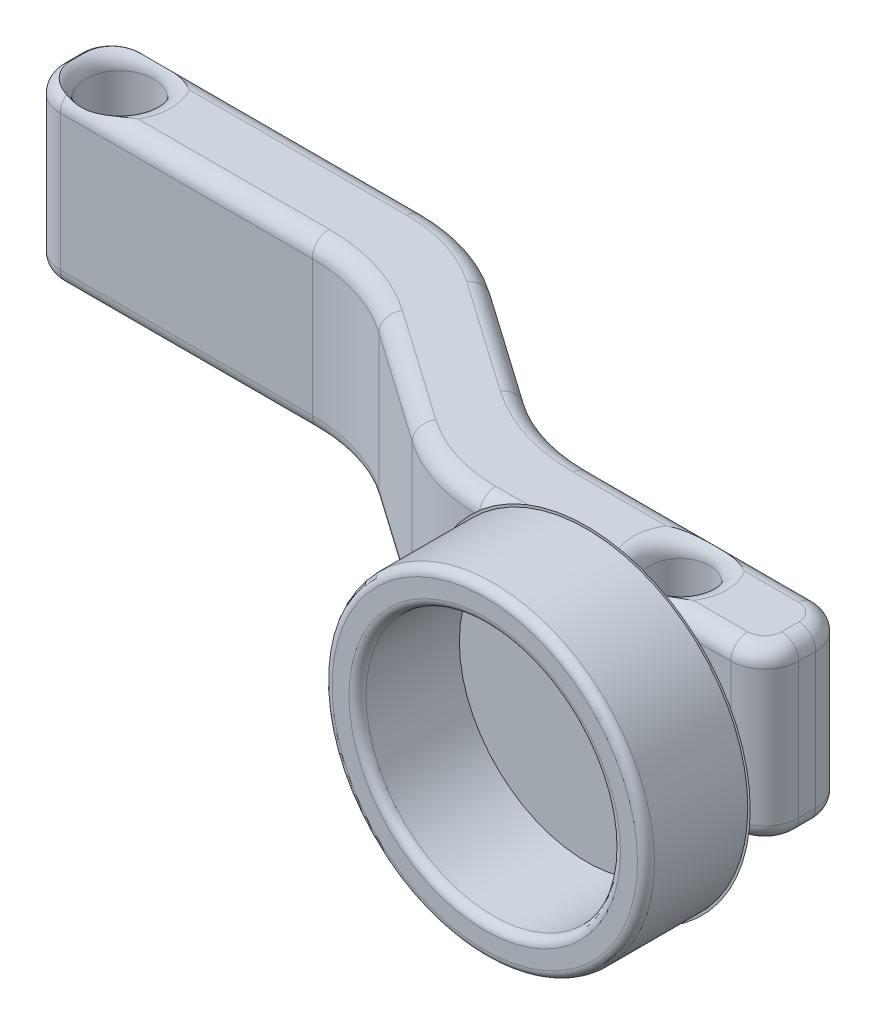
from build123d import *

# Parameters (mm, degrees)
BOSS_EXTRUDE1_DEPTH = 10
SKETCH2_R           = 1.75
SKETCH2_R_2         = 2
CUT_EXTRUDE1_DEPTH  = 10
FILLET2_R           = 1
SKETCH4_R           = 4
BOSS_EXTRUDE3_DEPTH = 3
BOSS_EXTRUDE3_DRAFT = -62
SKETCH3_R           = 9.5
SKETCH3_R_2         = 7.5
BOSS_EXTRUDE2_DEPTH = 6
FILLET4_R           = 0.5


with BuildPart() as part:
    # Sketch1 → Boss-Extrude1 (new body)
    with BuildSketch(Plane(origin=(0, 0, 0), x_dir=(1, 0, 0), z_dir=(0, 1, 0))):
        with BuildLine():
            Line((-2, 0), (-16.847012111, 0))
            ThreePointArc((-16.847012111, 0), (-19.854070106, 0.462830493), (-22.582776475, 1.808479557))
            Line((-22.582776475, 1.808479557), (-29.137351189, 6.398042182))
            ThreePointArc((-29.137351189, 6.398042182), (-31.866057558, 7.743691247), (-34.873115553, 8.206521739))
            Line((-34.873115553, 8.206521739), (-49.720127664, 8.206521739))
            ThreePointArc((-49.720127664, 8.206521739), (-51.134341226, 8.792308177), (-51.720127664, 10.206521739))
            Line((-51.720127664, 10.206521739), (-51.720127664, 11.206521739))
            ThreePointArc((-51.720127664, 11.206521739), (-51.134341226, 12.620735302), (-49.720127664, 13.206521739))
            Line((-49.720127664, 13.206521739), (-33.296621608, 13.206521739))
            ThreePointArc((-33.296621608, 13.206521739), (-30.289563613, 12.743691247), (-27.560857245, 11.398042182))
            Line((-27.560857245, 11.398042182), (-21.00628253, 6.808479557))
            ThreePointArc((-21.00628253, 6.808479557), (-18.277576162, 5.462830493), (-15.270518167, 5))
            Line((-15.270518167, 5), (-2, 5))
            ThreePointArc((-2, 5), (-0.585786438, 4.414213562), (0, 3))
            Line((0, 3), (0, 2))
            ThreePointArc((0, 2), (-0.585786438, 0.585786438), (-2, 0))
        make_face()
    extrude(amount=BOSS_EXTRUDE1_DEPTH)

    # Sketch2 → Cut-Extrude1 (cut)
    with BuildSketch(Plane(origin=(0, 10, 0), x_dir=(1, 0, 0), z_dir=(0, 1, 0))):
        with Locations(Location((-7.5, 2.5, 0), (0, 0, 270))):
            Circle(SKETCH2_R)
        with Locations(Location((-48.720127664, 10.706521739, 0), (0, 0, 270))):
            Circle(SKETCH2_R_2)
    extrude(amount=-CUT_EXTRUDE1_DEPTH, mode=Mode.SUBTRACT)

    # Fillet2
    # the kernel refuses this fillet: 1 mm, written as the material it takes off along each edge
    with BuildSketch(Plane(origin=(-2, 10, -2), x_dir=(1, 0, 0), z_dir=(0, 0, -1))) as fillet2_piece_1:
        with BuildLine():
            CenterArc((2 - FILLET2_R, FILLET2_R), FILLET2_R, 270, 90)
            Line((2, FILLET2_R), (2, 0))
            Line((2, 0), (2 - FILLET2_R, 0))
        make_face()
    revolve(axis=Axis((-2, 10, -2), (0, -1, 0)), revolution_arc=90, mode=Mode.SUBTRACT)
    with BuildSketch(Plane(origin=(-22.582776475, 0, -1.808479557), x_dir=(0.5735764363510469, 0, -0.8191520442889912), z_dir=(-0.8191520442889912, 0, -0.5735764363510469)), Plane(origin=(-27.560857245, 10, -11.398042182), x_dir=(0, -1, 0), z_dir=(0.8191520442889902, 0, 0.5735764363510484))) as fillet2_piece_2:
        with BuildLine():
            CenterArc((FILLET2_R, -FILLET2_R), FILLET2_R, 90, 90)
            Line((0, -FILLET2_R), (0, 0))
            Line((0, 0), (FILLET2_R, 0))
        make_face()
    extrude(amount=8.001658252, mode=Mode.SUBTRACT)
    with BuildSketch(Plane(origin=(-34.873115553, 0, 1.793478261), x_dir=(0.5735764363510476, 0, -0.8191520442889908), z_dir=(0.8191520442889908, 0, 0.5735764363510476))) as fillet2_piece_3:
        with BuildLine():
            CenterArc((10 + FILLET2_R, FILLET2_R), FILLET2_R, 180, 90)
            Line((10, FILLET2_R), (10, 0))
            Line((10, 0), (10 + FILLET2_R, 0))
        make_face()
    revolve(axis=Axis((-34.873115553, 0, 1.793478261), (0, 1, 0)), revolution_arc=35, mode=Mode.SUBTRACT)
    with BuildSketch(Plane(origin=(-34.873115553, 0, -8.206521739), x_dir=(0, 0, -1), z_dir=(-1, 0, 0)), Plane(origin=(-2, 0, 0), x_dir=(0, 0, -1), z_dir=(-1, 0, 0))) as fillet2_piece_4:
        with BuildLine():
            CenterArc((FILLET2_R, -FILLET2_R), FILLET2_R, 90, 90)
            Line((0, -FILLET2_R), (0, 0))
            Line((0, 0), (FILLET2_R, 0))
        make_face()
    extrude(amount=14.847012111, mode=Mode.SUBTRACT)
    with BuildSketch(Plane(origin=(0, 10, -3), x_dir=(-1, 0, 0), z_dir=(0, 0, 1)), Plane(origin=(-51.720127664, 10, -10.206521739), x_dir=(1, 0, 0), z_dir=(0, 0, -1))) as fillet2_piece_5:
        with BuildLine():
            CenterArc((FILLET2_R, FILLET2_R), FILLET2_R, 180, 90)
            Line((0, FILLET2_R), (0, 0))
            Line((0, 0), (FILLET2_R, 0))
        make_face()
    extrude(amount=1, mode=Mode.SUBTRACT)
    with BuildSketch(Plane(origin=(-49.720127664, 0, -10.206521739), x_dir=(0, 0, 1), z_dir=(1, 0, 0))) as fillet2_piece_6:
        with BuildLine():
            CenterArc((2 - FILLET2_R, -FILLET2_R), FILLET2_R, 0, 90)
            Line((2, -FILLET2_R), (2, 0))
            Line((2, 0), (2 - FILLET2_R, 0))
        make_face()
    revolve(axis=Axis((-49.720127664, 0, -10.206521739), (0, -1, 0)), revolution_arc=90, mode=Mode.SUBTRACT)
    with BuildSketch(Plane(origin=(-51.720127664, 0, -10.206521739), x_dir=(1, 0, 0), z_dir=(0, 0, -1)), Plane(origin=(0, 0, -3), x_dir=(-1, 0, 0), z_dir=(0, 0, 1))) as fillet2_piece_7:
        with BuildLine():
            CenterArc((FILLET2_R, -FILLET2_R), FILLET2_R, 90, 90)
            Line((0, -FILLET2_R), (0, 0))
            Line((0, 0), (FILLET2_R, 0))
        make_face()
    extrude(amount=1, mode=Mode.SUBTRACT)
    with BuildSketch(Plane(origin=(-49.720127664, 0, -11.206521739), x_dir=(-1, 0, 0), z_dir=(0, 0, 1))) as fillet2_piece_8:
        with BuildLine():
            CenterArc((2 - FILLET2_R, -FILLET2_R), FILLET2_R, 0, 90)
            Line((2, -FILLET2_R), (2, 0))
            Line((2, 0), (2 - FILLET2_R, 0))
        make_face()
    revolve(axis=Axis((-49.720127664, 0, -11.206521739), (0, -1, 0)), revolution_arc=90, mode=Mode.SUBTRACT)
    with BuildSketch(Plane(origin=(-49.720127664, 0, -13.206521739), x_dir=(0, 0, 1), z_dir=(1, 0, 0))) as fillet2_piece_9:
        with BuildLine():
            CenterArc((FILLET2_R, -FILLET2_R), FILLET2_R, 90, 90)
            Line((0, -FILLET2_R), (0, 0))
            Line((0, 0), (FILLET2_R, 0))
        make_face()
    extrude(amount=16.423506056, mode=Mode.SUBTRACT)
    with BuildSketch(Plane(origin=(-33.296621608, 0, -3.206521739), x_dir=(0, 0, -1), z_dir=(-1, 0, 0))) as fillet2_piece_10:
        with BuildLine():
            CenterArc((10 - FILLET2_R, -FILLET2_R), FILLET2_R, 0, 90)
            Line((10 - FILLET2_R, 0), (10, 0))
            Line((10, 0), (10, -FILLET2_R))
        make_face()
    revolve(axis=Axis((-33.296621608, 0, -3.206521739), (0, -1, 0)), revolution_arc=35, mode=Mode.SUBTRACT)
    with BuildSketch(Plane(origin=(-27.560857245, 0, -11.398042182), x_dir=(0, 1, 0), z_dir=(0.8191520442889902, 0, 0.5735764363510484)), Plane(origin=(-22.582776475, 10, -1.808479557), x_dir=(0.5735764363510469, 0, -0.8191520442889912), z_dir=(-0.8191520442889912, 0, -0.5735764363510469))) as fillet2_piece_11:
        with BuildLine():
            CenterArc((FILLET2_R, FILLET2_R), FILLET2_R, 180, 90)
            Line((0, FILLET2_R), (0, 0))
            Line((0, 0), (FILLET2_R, 0))
        make_face()
    extrude(amount=8.001658252, mode=Mode.SUBTRACT)
    with BuildSketch(Plane(origin=(-15.270518167, 0, -15), x_dir=(-0.573576436351048, 0, 0.8191520442889905), z_dir=(-0.8191520442889905, 0, -0.573576436351048))) as fillet2_piece_12:
        with BuildLine():
            CenterArc((10 + FILLET2_R, FILLET2_R), FILLET2_R, 180, 90)
            Line((10 + FILLET2_R, 0), (10, 0))
            Line((10, 0), (10, FILLET2_R))
        make_face()
    revolve(axis=Axis((-15.270518167, 0, -15), (0, 1, 0)), revolution_arc=35, mode=Mode.SUBTRACT)
    with BuildSketch(Plane(origin=(-15.270518167, 0, -5), x_dir=(0, 0, 1), z_dir=(1, 0, 0))) as fillet2_piece_13:
        with BuildLine():
            CenterArc((FILLET2_R, -FILLET2_R), FILLET2_R, 90, 90)
            Line((0, -FILLET2_R), (0, 0))
            Line((0, 0), (FILLET2_R, 0))
        make_face()
    extrude(amount=13.270518167, mode=Mode.SUBTRACT)
    with BuildSketch(Plane(origin=(-2, 0, -3), x_dir=(0, 0, -1), z_dir=(-1, 0, 0))) as fillet2_piece_14:
        with BuildLine():
            CenterArc((2 - FILLET2_R, -FILLET2_R), FILLET2_R, 0, 90)
            Line((2, -FILLET2_R), (2, 0))
            Line((2, 0), (2 - FILLET2_R, 0))
        make_face()
    revolve(axis=Axis((-2, 0, -3), (0, -1, 0)), revolution_arc=90, mode=Mode.SUBTRACT)
    with BuildSketch(Plane(origin=(-2, 10, -3), x_dir=(0, 0, -1), z_dir=(-1, 0, 0))) as fillet2_piece_15:
        with BuildLine():
            CenterArc((2 - FILLET2_R, FILLET2_R), FILLET2_R, 270, 90)
            Line((2, FILLET2_R), (2, 0))
            Line((2, 0), (2 - FILLET2_R, 0))
        make_face()
    revolve(axis=Axis((-2, 10, -3), (0, -1, 0)), revolution_arc=90, mode=Mode.SUBTRACT)
    with BuildSketch(Plane(origin=(-2, 0, -2), x_dir=(1, 0, 0), z_dir=(0, 0, -1))) as fillet2_piece_16:
        with BuildLine():
            CenterArc((2 - FILLET2_R, -FILLET2_R), FILLET2_R, 0, 90)
            Line((2, -FILLET2_R), (2, 0))
            Line((2, 0), (2 - FILLET2_R, 0))
        make_face()
    revolve(axis=Axis((-2, 0, -2), (0, -1, 0)), revolution_arc=90, mode=Mode.SUBTRACT)
    with BuildSketch(Plane(origin=(-16.847012111, 0, -10), x_dir=(0, 0, 1), z_dir=(1, 0, 0))) as fillet2_piece_17:
        with BuildLine():
            CenterArc((10 - FILLET2_R, -FILLET2_R), FILLET2_R, 0, 90)
            Line((10, -FILLET2_R), (10, 0))
            Line((10, 0), (10 - FILLET2_R, 0))
        make_face()
    revolve(axis=Axis((-16.847012111, 0, -10), (0, -1, 0)), revolution_arc=35, mode=Mode.SUBTRACT)
    with BuildSketch(Plane(origin=(-15.270518167, 10, -5), x_dir=(0, 0, 1), z_dir=(1, 0, 0))) as fillet2_piece_18:
        with BuildLine():
            CenterArc((FILLET2_R, FILLET2_R), FILLET2_R, 180, 90)
            Line((0, FILLET2_R), (0, 0))
            Line((0, 0), (FILLET2_R, 0))
        make_face()
    extrude(amount=13.270518167, mode=Mode.SUBTRACT)
    with BuildSketch(Plane(origin=(-15.270518167, 10, -15), x_dir=(-0.573576436351048, 0, 0.8191520442889905), z_dir=(-0.8191520442889905, 0, -0.573576436351048))) as fillet2_piece_19:
        with BuildLine():
            CenterArc((10 + FILLET2_R, -FILLET2_R), FILLET2_R, 90, 90)
            Line((10 + FILLET2_R, 0), (10, 0))
            Line((10, 0), (10, -FILLET2_R))
        make_face()
    revolve(axis=Axis((-15.270518167, 10, -15), (0, 1, 0)), revolution_arc=35, mode=Mode.SUBTRACT)
    with BuildSketch(Plane(origin=(-33.296621608, 10, -3.206521739), x_dir=(0, 0, -1), z_dir=(-1, 0, 0))) as fillet2_piece_20:
        with BuildLine():
            CenterArc((10 - FILLET2_R, FILLET2_R), FILLET2_R, 270, 90)
            Line((10 - FILLET2_R, 0), (10, 0))
            Line((10, 0), (10, FILLET2_R))
        make_face()
    revolve(axis=Axis((-33.296621608, 10, -3.206521739), (0, -1, 0)), revolution_arc=35, mode=Mode.SUBTRACT)
    with BuildSketch(Plane(origin=(-49.720127664, 10, -13.206521739), x_dir=(0, 0, 1), z_dir=(1, 0, 0))) as fillet2_piece_21:
        with BuildLine():
            CenterArc((FILLET2_R, FILLET2_R), FILLET2_R, 180, 90)
            Line((0, FILLET2_R), (0, 0))
            Line((0, 0), (FILLET2_R, 0))
        make_face()
    extrude(amount=16.423506056, mode=Mode.SUBTRACT)
    with BuildSketch(Plane(origin=(-49.720127664, 10, -11.206521739), x_dir=(-1, 0, 0), z_dir=(0, 0, 1))) as fillet2_piece_22:
        with BuildLine():
            CenterArc((2 - FILLET2_R, FILLET2_R), FILLET2_R, 270, 90)
            Line((2, FILLET2_R), (2, 0))
            Line((2, 0), (2 - FILLET2_R, 0))
        make_face()
    revolve(axis=Axis((-49.720127664, 10, -11.206521739), (0, -1, 0)), revolution_arc=90, mode=Mode.SUBTRACT)
    with BuildSketch(Plane(origin=(-16.847012111, 10, -10), x_dir=(0, 0, 1), z_dir=(1, 0, 0))) as fillet2_piece_23:
        with BuildLine():
            CenterArc((10 - FILLET2_R, FILLET2_R), FILLET2_R, 270, 90)
            Line((10, FILLET2_R), (10, 0))
            Line((10, 0), (10 - FILLET2_R, 0))
        make_face()
    revolve(axis=Axis((-16.847012111, 10, -10), (0, -1, 0)), revolution_arc=35, mode=Mode.SUBTRACT)
    with BuildSketch(Plane(origin=(-7.5, 0, -2.5), x_dir=(0, 0, 1), z_dir=(-1, 0, 0))) as fillet2_piece_24:
        with BuildLine():
            CenterArc((1.75 + FILLET2_R, FILLET2_R), FILLET2_R, 180, 90)
            Line((1.75, FILLET2_R), (1.75, 0))
            Line((1.75, 0), (1.75 + FILLET2_R, 0))
        make_face()
    revolve(axis=Axis((-7.5, 0, -2.5), (0, 1, 0)), mode=Mode.SUBTRACT)
    with BuildSketch(Plane(origin=(-7.5, 10, -2.5), x_dir=(0, 0, 1), z_dir=(-1, 0, 0))) as fillet2_piece_25:
        with BuildLine():
            CenterArc((1.75 + FILLET2_R, -FILLET2_R), FILLET2_R, 90, 90)
            Line((1.75, -FILLET2_R), (1.75, 0))
            Line((1.75, 0), (1.75 + FILLET2_R, 0))
        make_face()
    revolve(axis=Axis((-7.5, 10, -2.5), (0, 1, 0)), mode=Mode.SUBTRACT)
    with BuildSketch(Plane(origin=(-49.720127664, 10, -10.206521739), x_dir=(0, 0, 1), z_dir=(1, 0, 0))) as fillet2_piece_26:
        with BuildLine():
            CenterArc((2 - FILLET2_R, FILLET2_R), FILLET2_R, 270, 90)
            Line((2, FILLET2_R), (2, 0))
            Line((2, 0), (2 - FILLET2_R, 0))
        make_face()
    revolve(axis=Axis((-49.720127664, 10, -10.206521739), (0, -1, 0)), revolution_arc=90, mode=Mode.SUBTRACT)
    with BuildSketch(Plane(origin=(-48.720127664, 0, -10.706521739), x_dir=(0, 0, 1), z_dir=(-1, 0, 0))) as fillet2_piece_27:
        with BuildLine():
            CenterArc((2 + FILLET2_R, FILLET2_R), FILLET2_R, 180, 90)
            Line((2, FILLET2_R), (2, 0))
            Line((2, 0), (2 + FILLET2_R, 0))
        make_face()
    revolve(axis=Axis((-48.720127664, 0, -10.706521739), (0, 1, 0)), mode=Mode.SUBTRACT)
    with BuildSketch(Plane(origin=(-48.720127664, 10, -10.706521739), x_dir=(0, 0, 1), z_dir=(-1, 0, 0))) as fillet2_piece_28:
        with BuildLine():
            CenterArc((2 + FILLET2_R, -FILLET2_R), FILLET2_R, 90, 90)
            Line((2, -FILLET2_R), (2, 0))
            Line((2, 0), (2 + FILLET2_R, 0))
        make_face()
    revolve(axis=Axis((-48.720127664, 10, -10.706521739), (0, 1, 0)), mode=Mode.SUBTRACT)
    with BuildSketch(Plane(origin=(-34.873115553, 10, -8.206521739), x_dir=(0, 0, -1), z_dir=(-1, 0, 0)), Plane(origin=(-2, 10, 0), x_dir=(0, 0, -1), z_dir=(-1, 0, 0))) as fillet2_piece_29:
        with BuildLine():
            CenterArc((FILLET2_R, FILLET2_R), FILLET2_R, 180, 90)
            Line((0, FILLET2_R), (0, 0))
            Line((0, 0), (FILLET2_R, 0))
        make_face()
    extrude(amount=14.847012111, mode=Mode.SUBTRACT)
    with BuildSketch(Plane(origin=(-34.873115553, 10, 1.793478261), x_dir=(0.5735764363510476, 0, -0.8191520442889908), z_dir=(0.8191520442889908, 0, 0.5735764363510476))) as fillet2_piece_30:
        with BuildLine():
            CenterArc((10 + FILLET2_R, -FILLET2_R), FILLET2_R, 90, 90)
            Line((10, -FILLET2_R), (10, 0))
            Line((10, 0), (10 + FILLET2_R, 0))
        make_face()
    revolve(axis=Axis((-34.873115553, 10, 1.793478261), (0, 1, 0)), revolution_arc=35, mode=Mode.SUBTRACT)


with BuildPart() as boss_extrude3_tool:
    # Sketch4 → Boss-Extrude3 (with draft: the straight prism first)
    with BuildSketch(Plane.XY):
        with Locations((-7.5, 5)):
            Circle(SKETCH4_R)
    extrude(amount=BOSS_EXTRUDE3_DEPTH)
    # Boss-Extrude3: the draft: its side faces are tilted about the plane it starts from
    boss_extrude3_sides = [boss_extrude3_tool.faces().sort_by_distance(p)[0] for p in [
        (-11.5, 5, 1.5),
    ]]
    draft(boss_extrude3_sides, Plane.XY, BOSS_EXTRUDE3_DRAFT)


with BuildPart() as part_1:
    add(part.part)

    # Boss-Extrude3: add boss_extrude3_tool
    add(boss_extrude3_tool.part)


with BuildPart() as body_2:
    # Sketch3 → Boss-Extrude2 (new body)
    with BuildSketch(Plane.XY.offset(3)):
        with Locations((-7.5, 5)):
            Circle(SKETCH3_R)
        with Locations((-7.5, 5)):
            Circle(SKETCH3_R_2, mode=Mode.SUBTRACT)
    extrude(amount=BOSS_EXTRUDE2_DEPTH)

    # Fillet4
    fillet4_edges = [body_2.edges().sort_by_distance(p)[0] for p in [
        (-17, 5, 9),
        (-15, 5, 9),
    ]]
    fillet(fillet4_edges, radius=FILLET4_R)


solid = Compound([part_1.part, body_2.part])
